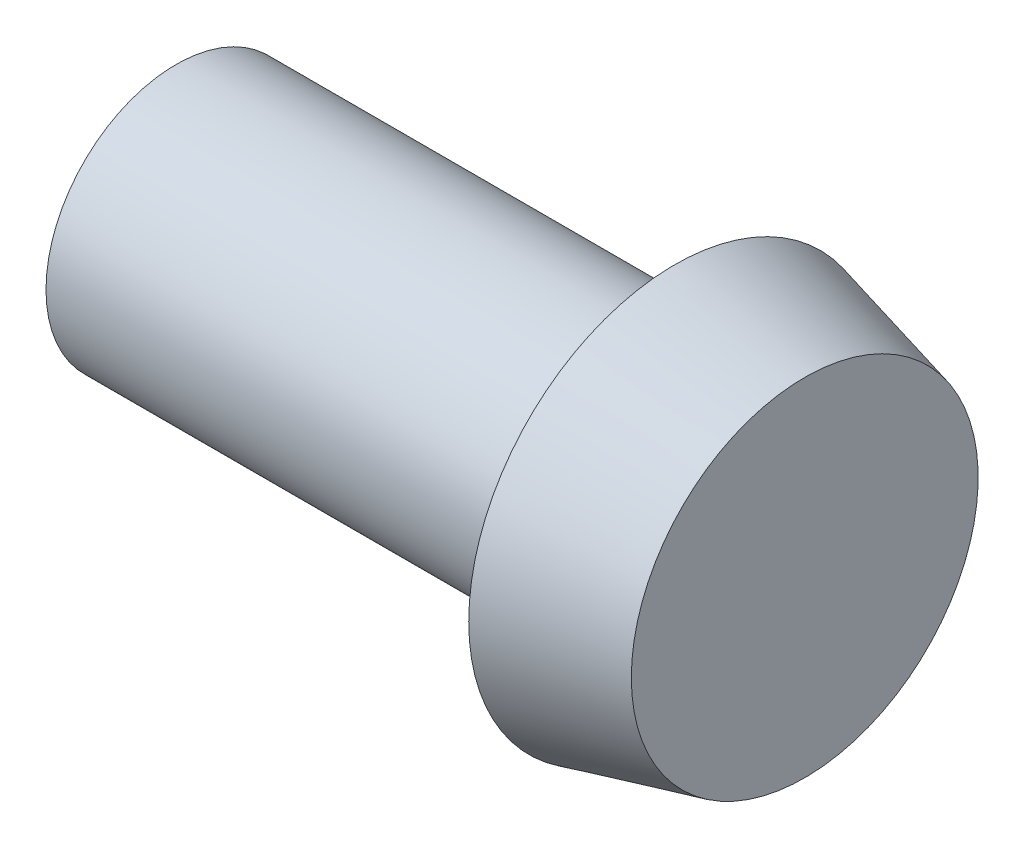
from build123d import *


with BuildPart() as part:
    # Sketch5 → Revolve2 (revolve)
    with BuildSketch(Plane(origin=(0, 0, 0), x_dir=(1, 0, 0), z_dir=(0, 1, 0))):
        Polygon((0, 6), (-23, 6), (-23, 0), (6, 0), (6, 8), (0, 9.5), align=None)
    revolve(axis=Axis((-30.464980446, 0, 0), (1, 0, 0)))


solid = part.part
